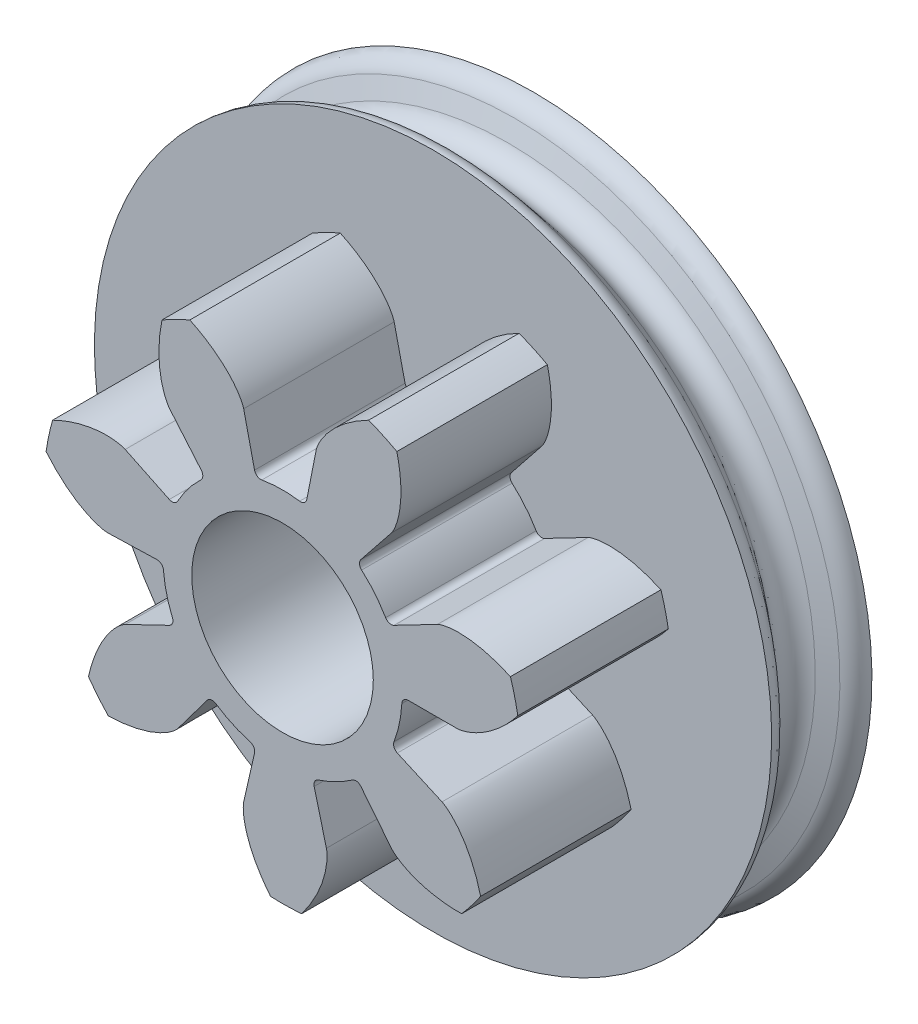
from build123d import *

# Parameters (mm, degrees)
SKETCH2_R                = 9.525
BOSS_EXTRUDE1_DEPTH      = 6
CUT_EXTRUDE1_DEPTH       = 6
FILLET1_R                = 0.254
CIRPATTERN3_COUNT        = 7
FILLET1_OF_CIRPATTERN3_R = 0.254
SKETCH5_R                = 3.6195
CUT_EXTRUDE2_DEPTH       = 22.552262188


# Read off the part's stored shape, not the designer's step: Cut-Extrude1
with BuildPart() as part:
    # Sketch2 → Boss-Extrude1 (new body)
    with BuildSketch(Plane.XY):
        Circle(SKETCH2_R)
    extrude(amount=BOSS_EXTRUDE1_DEPTH)

    # Cut-Extrude1 outline → Cut-Extrude1 (cut)
    with BuildSketch(Plane.XY):
        with BuildLine():
            add(Edge.make_bspline(
                [(7.897843079, -5.324443605), (7.889143341, -5.289999139), (7.867227424, -5.205648747), (7.827727113, -5.060059729), (7.771666127, -4.883663277), (7.701398596, -4.679948485), (7.625552695, -4.488360923), (7.541233, -4.294097512), (7.449800697, -4.106928499), (7.349957655, -3.921669386), (7.243971635, -3.745871788), (7.144005576, -3.596252965), (7.053247562, -3.472826422), (6.97418145, -3.373120571), (6.906540088, -3.293141366), (6.83627385, -3.215340389), (6.763281904, -3.140161429), (6.687469161, -3.067922243), (6.615142647, -3.004844734), (6.547015129, -2.950588631), (6.487230743, -2.907407915), (6.439655955, -2.876083449), (6.401232447, -2.853389362), (6.377134376, -2.840501757), (6.364085781, -2.83432127), (6.359383216, -2.832226927)],
                knots=[0.125661341, 0.125661341, 0.125661341, 0.125661341, 0.125661341, 0.164197228, 0.218929529, 0.273661934, 0.328394301, 0.383126635, 0.43785898, 0.492591256, 0.547323565, 0.602055884, 0.652783571, 0.680149903, 0.707515961, 0.734882063, 0.762248421, 0.789614741, 0.816980391, 0.844236067, 0.862480777, 0.880559096, 0.894007228, 0.903714168, 0.909090916, 0.909090916, 0.909090916, 0.909090916, 0.909090916], degree=4))
            ThreePointArc((7.897843079, -5.324443605), (9.316745812, -1.980876693), (9.380868546, 1.6507363))
            add(Edge.make_bspline(
                [(6.961556166, 0), (6.966704019, 0), (6.981138372, 0.000337209), (7.008395135, 0.002306025), (7.052727841, 0.007404928), (7.10893141, 0.016664594), (7.181112025, 0.031787617), (7.265419984, 0.053633703), (7.357152611, 0.081829835), (7.45579723, 0.116976829), (7.553061062, 0.155956916), (7.648901697, 0.198441138), (7.743230692, 0.24398307), (7.856021752, 0.302897275), (7.989143851, 0.378723625), (8.141333522, 0.474730445), (8.309672953, 0.592202432), (8.476250078, 0.720816713), (8.635921012, 0.854597498), (8.791980848, 0.997752698), (8.939211234, 1.141910972), (9.086279598, 1.299416968), (9.209256135, 1.437747419), (9.304570852, 1.554672786), (9.358908009, 1.622810658), (9.380868546, 1.6507363)],
                knots=[0, 0, 0, 0, 0, 0.005376748, 0.015083688, 0.02853182, 0.046610139, 0.064854849, 0.092110525, 0.119476175, 0.146842495, 0.174208853, 0.201574955, 0.228941013, 0.256307345, 0.307035032, 0.361767351, 0.41649966, 0.471231936, 0.525964281, 0.580696615, 0.635428982, 0.690161387, 0.744893688, 0.783429575, 0.783429575, 0.783429575, 0.783429575, 0.783429575], degree=4))
            Line((6.961556166, 0), (4.7625, 0))
            ThreePointArc((4.7625, 0), (4.658372906, -0.990438347), (4.350544885, -1.937566891))
            Line((4.350544885, -1.937566891), (6.359383216, -2.832226927))
        make_face()
    cut_extrude1 = extrude(amount=CUT_EXTRUDE1_DEPTH, mode=Mode.SUBTRACT)

    # Fillet1
    fillet1_edges = [part.edges().sort_by_distance(p)[0] for p in [
        (4.350544885, -1.937566891, 3),
        (4.7625, 0, 3),
    ]]
    fillet(fillet1_edges, radius=FILLET1_R)

    # CirPattern3: Cut-Extrude1 ×7 about axis
    cirpattern3_axis = Axis((0, 0, 55), (0, 0, -1))
    for i in range(1, CIRPATTERN3_COUNT):
        add(cut_extrude1.rotate(cirpattern3_axis, i * 360 / CIRPATTERN3_COUNT), mode=Mode.SUBTRACT)

    # Fillet1 of CirPattern3
    fillet1_of_cirpattern3_edges = [part.edges().sort_by_distance(p)[0] for p in [
        (1.197669574, -4.609446154, 3),
        (2.969370181, -3.723472435, 3),
        (-2.857075355, -3.810318447, 3),
        (-1.059755948, -4.643094182, 3),
        (-4.760384267, -0.141943234, 3),
        (-4.290864233, -2.066371308, 3),
        (-3.079026732, 3.63331813, 3),
        (-4.290864233, 2.066371308, 3),
        (0.920900733, 4.672616836, 3),
        (-1.059755948, 4.643094182, 3),
        (4.227371163, 2.19333976, 3),
        (2.969370181, 3.723472435, 3),
    ]]
    fillet(fillet1_of_cirpattern3_edges, radius=FILLET1_OF_CIRPATTERN3_R)

    # Sketch4 → Revolve1 (revolve)
    with BuildSketch(Plane(origin=(0, 0, 0), x_dir=(0, 0, -1), z_dir=(1, 0, 0))):
        with BuildLine():
            Line((0, 0), (0, 13.5))
            ThreePointArc((0, 13.5), (0.338094609, 13.42504623), (0.612835554, 13.214230088))
            Line((0.612835554, 13.214230088), (1.621351964, 12.012327033))
            ThreePointArc((1.621351964, 12.012327033), (2.373106061, 11.738710919), (2.985941615, 12.252941006))
            Line((2.985941615, 12.252941006), (3.248245903, 12.973616115))
            ThreePointArc((3.248245903, 12.973616115), (3.541138851, 13.355321635), (4, 13.5))
            Line((4, 13.5), (4, 0))
            Line((4, 0), (0, 0))
        make_face()
    revolve(axis=Axis((0, 0, -4), (0, 0, 1)))

    # Sketch5 → Cut-Extrude2 (cut, through all)
    with BuildSketch(Plane.XY.offset(6)):
        Circle(SKETCH5_R)
    extrude(amount=-CUT_EXTRUDE2_DEPTH, mode=Mode.SUBTRACT)


solid = part.part
